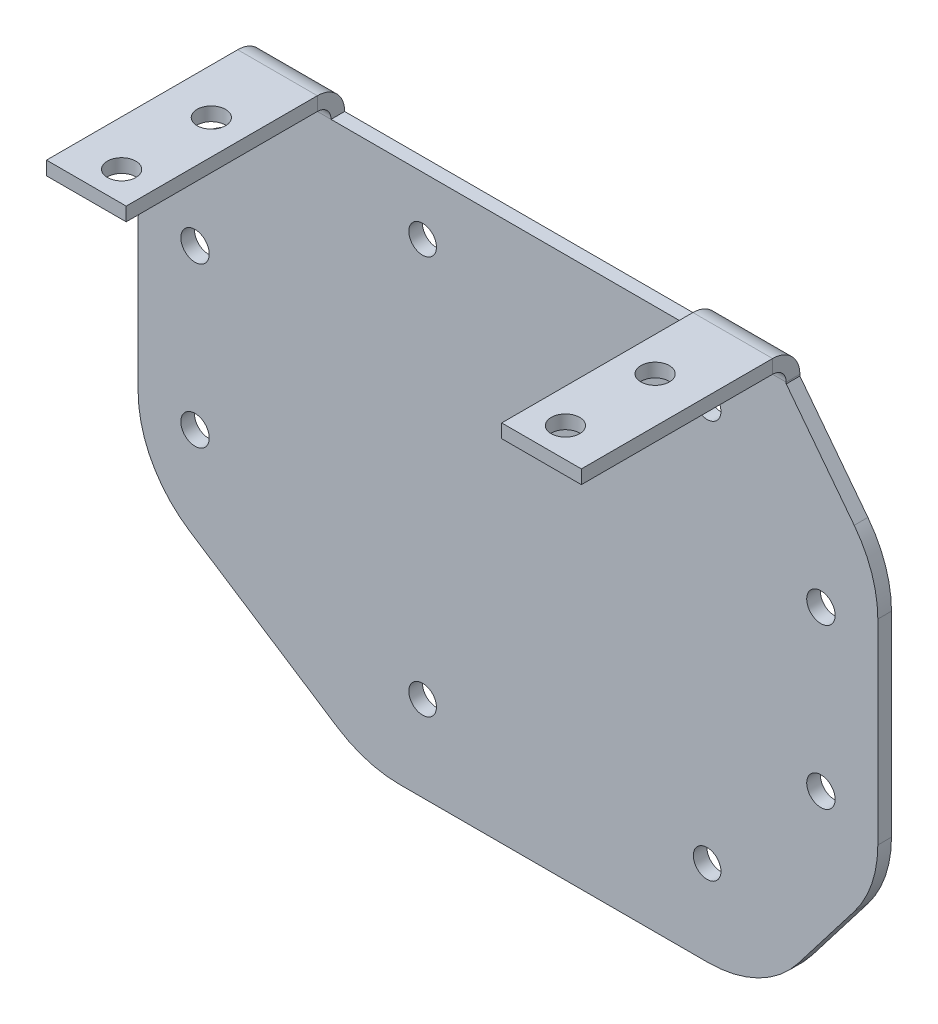
from build123d import *

# Parameters (mm, degrees)
SKETCH1_W               = 82.55
SKETCH1_H               = 63.5
BOSS_EXTRUDE1_DEPTH     = 1.524
SKETCH2_OUTSIDE_W       = 105.382
SKETCH2_OUTSIDE_H       = 86.332
SKETCH2_OUTSIDE_R       = 1.54305
SKETCH2_OUTSIDE_R_2     = 1.5875
CUT_EXTRUDE1_DEPTH      = 53.096167815
SKETCH3_W               = 8.89
SKETCH3_H               = 1.524
BOSS_EXTRUDE2_DEPTH     = 22.86
CONVERT_SOLID2_START    = -28.6385
CONVERT_SOLID2_DEPTH    = 59.69
CONVERT_SOLID2_2_DEPTH  = 8.89
CONVERT_SOLID2_START_2  = 22.1615
CONVERT_SOLID2_3_DEPTH  = 8.89
CUT_EXTRUDE2_DEPTH      = 79.353236417
CUT_EXTRUDE2_DEPTH_BACK = 79.353236417
SKETCH12_R              = 1.5875


# Read off the part's stored shape, not the designer's step: Convert-Solid2
with BuildPart() as part:
    # Sketch1 → Boss-Extrude1 (new body)
    with BuildSketch(Plane.XY):
        Rectangle(SKETCH1_W, SKETCH1_H)
    extrude(amount=BOSS_EXTRUDE1_DEPTH)

    # Sketch2 outside → Cut-Extrude1 (cut, through all)
    # profile 1 of 9: a face of its own
    with BuildSketch(Plane.XY.offset(1.524)):
        Rectangle(SKETCH2_OUTSIDE_W, SKETCH2_OUTSIDE_H)
        with BuildLine():
            Line((-41.275, 8.347887239), (-41.275, -8.347887239))
            ThreePointArc((-41.275, -8.347887239), (-39.737239271, -14.405478713), (-35.496352053, -18.996121166))
            Line((-35.496352053, -18.996121166), (-19.031563189, -29.698233927))
            ThreePointArc((-19.031563189, -29.698233927), (-15.719742209, -31.22625909), (-12.110211137, -31.75))
            Line((-12.110211137, -31.75), (22.321500982, -31.75))
            ThreePointArc((22.321500982, -31.75), (27.931748365, -30.443644031), (32.387825644, -26.793326663))
            Line((32.387825644, -26.793326663), (38.641324662, -18.66377794))
            ThreePointArc((38.641324662, -18.66377794), (40.598566925, -15.009930266), (41.275, -10.920451277))
            Line((41.275, -10.920451277), (41.275, 10.920451277))
            ThreePointArc((41.275, 10.920451277), (40.598566925, 15.009930266), (38.641324662, 18.66377794))
            Line((38.641324662, 18.66377794), (31.0515, 28.53055))
            Line((31.0515, 28.53055), (31.0515, 31.75))
            Line((31.0515, 31.75), (22.1615, 31.75))
            Line((22.1615, 31.75), (22.1615, 28.702))
            Line((22.1615, 28.702), (-19.7485, 28.702))
            Line((-19.7485, 28.702), (-19.7485, 31.75))
            Line((-19.7485, 31.75), (-28.6385, 31.75))
            Line((-28.6385, 31.75), (-28.6385, 23.453725))
            Line((-28.6385, 23.453725), (-35.496352053, 18.996121166))
            ThreePointArc((-35.496352053, 18.996121166), (-39.737239271, 14.405478713), (-41.275, 8.347887239))
        make_face(mode=Mode.SUBTRACT)
    # profile 2 of 9: a face of its own
    with BuildSketch(Plane.XY.offset(1.524)):
        with Locations((-9.525, 22.225)):
            Circle(SKETCH2_OUTSIDE_R)
    # profile 3 of 9: a face of its own
    with BuildSketch(Plane.XY.offset(1.524)):
        with Locations((22.225, 22.225)):
            Circle(SKETCH2_OUTSIDE_R)
    # profile 4 of 9: a face of its own
    with BuildSketch(Plane.XY.offset(1.524)):
        with Locations((22.225, -22.225)):
            Circle(SKETCH2_OUTSIDE_R)
    # profile 5 of 9: a face of its own
    with BuildSketch(Plane.XY.offset(1.524)):
        with Locations((-9.525, -22.225)):
            Circle(SKETCH2_OUTSIDE_R)
    # profile 6 of 9: a face of its own
    with BuildSketch(Plane.XY.offset(1.524)):
        with Locations((34.925, -8.89)):
            Circle(SKETCH2_OUTSIDE_R_2)
    # profile 7 of 9: a face of its own
    with BuildSketch(Plane.XY.offset(1.524)):
        with Locations((34.925, 8.89)):
            Circle(SKETCH2_OUTSIDE_R_2)
    # profile 8 of 9: a face of its own
    with BuildSketch(Plane.XY.offset(1.524)):
        with Locations((-34.925, -8.89)):
            Circle(SKETCH2_OUTSIDE_R_2)
    # profile 9 of 9: a face of its own
    with BuildSketch(Plane.XY.offset(1.524)):
        with Locations((-34.925, 8.89)):
            Circle(SKETCH2_OUTSIDE_R_2)
    extrude(amount=-CUT_EXTRUDE1_DEPTH, mode=Mode.SUBTRACT)

    # Sketch3 → Boss-Extrude2 (add)
    with BuildSketch(Plane.XY.offset(1.524)):
        with Locations((-24.1935, 30.988)):
            Rectangle(SKETCH3_W, SKETCH3_H)
        with Locations((26.6065, 30.988)):
            Rectangle(SKETCH3_W, SKETCH3_H)
    extrude(amount=BOSS_EXTRUDE2_DEPTH)

    # Convert-Solid2 outline → Convert-Solid2 (cut)
    with BuildSketch(Plane.YZ.offset(CONVERT_SOLID2_START)):
        with BuildLine():
            ThreePointArc((31.75, 3.048), (30.857261469, 0.892738531), (28.702, 0))
            Line((28.702, 0), (31.75, 0))
            Line((31.75, 0), (31.75, 3.048))
        make_face()
    extrude(amount=CONVERT_SOLID2_DEPTH, mode=Mode.SUBTRACT)

    # Convert-Solid2 2 outline → Convert-Solid2 2 (add)
    with BuildSketch(Plane.YZ.offset(CONVERT_SOLID2_START)):
        with BuildLine():
            ThreePointArc((30.226, 3.048), (29.779630735, 1.970369265), (28.702, 1.524))
            Line((28.702, 1.524), (30.226, 1.524))
            Line((30.226, 1.524), (30.226, 3.048))
        make_face()
    extrude(amount=CONVERT_SOLID2_2_DEPTH)

    # Convert-Solid2 3 outline → Convert-Solid2 3 (add)
    with BuildSketch(Plane.YZ.offset(CONVERT_SOLID2_START_2)):
        with BuildLine():
            ThreePointArc((30.226, 3.048), (29.779630735, 1.970369265), (28.702, 1.524))
            Line((28.702, 1.524), (30.226, 1.524))
            Line((30.226, 1.524), (30.226, 3.048))
        make_face()
    extrude(amount=CONVERT_SOLID2_3_DEPTH)

    # Sketch12 → Cut-Extrude2 (cut, two sides: drawn at the far end of the back side and taken through both)
    with BuildSketch(Plane.XZ.offset(-30.226).offset(-CUT_EXTRUDE2_DEPTH_BACK)):
        with Locations(Location((-23.5585, 21.082, 0), (0, 0, 270))):
            Circle(SKETCH12_R)
        with Locations(Location((-23.5585, 11.0744, 0), (0, 0, 270))):
            Circle(SKETCH12_R)
        with Locations(Location((25.9715, 21.082, 0), (0, 0, 270))):
            Circle(SKETCH12_R)
        with Locations(Location((25.9715, 11.0744, 0), (0, 0, 270))):
            Circle(SKETCH12_R)
    extrude(amount=CUT_EXTRUDE2_DEPTH + CUT_EXTRUDE2_DEPTH_BACK, mode=Mode.SUBTRACT)


solid = part.part
